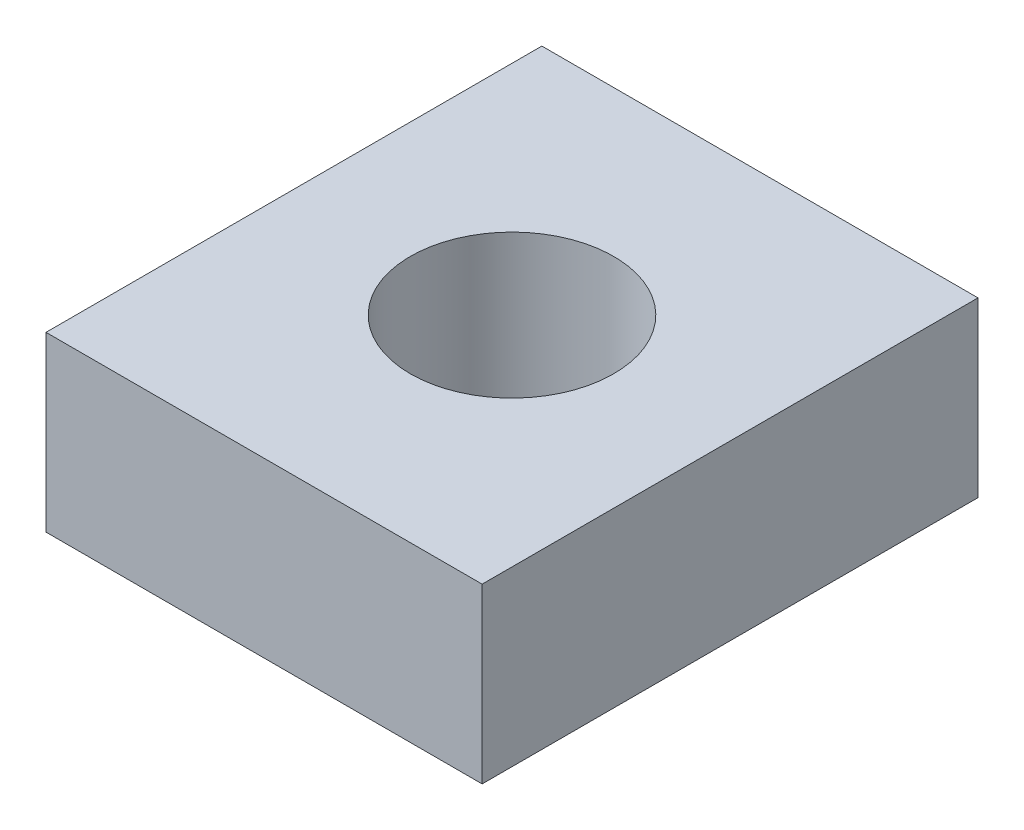
from build123d import *

# Parameters (mm, degrees)
SKETCH1_W               = 10.9474
SKETCH1_H               = 12.446
BOSS_EXTRUDE1_DEPTH     = 4.3434
F_1_4_20_TAPPED_HOLE1_D = 5.1054


with BuildPart() as part:
    # Sketch1 → Boss-Extrude1 (new body)
    with BuildSketch(Plane(origin=(0, 0, 0), x_dir=(1, 0, 0), z_dir=(0, 1, 0))):
        Rectangle(SKETCH1_W, SKETCH1_H)
    extrude(amount=BOSS_EXTRUDE1_DEPTH)

    # 1/4-20 Tapped Hole1 (through all)
    with Locations(Plane(origin=(0, 4.3434, 0), x_dir=(1, 0, 0), z_dir=(0, 1, 0))):
        with Locations((0, 0)):
            Hole(F_1_4_20_TAPPED_HOLE1_D / 2)


solid = part.part
